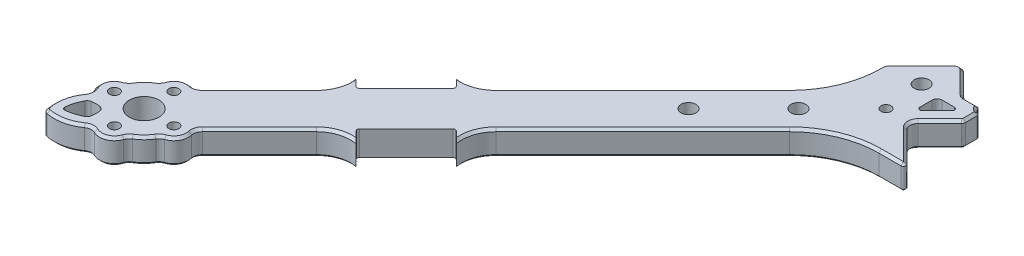
from build123d import *

# Parameters (mm, degrees)
SKETCH_1_R          = 1
SKETCH_1_R_2        = 3
SKETCH_1_R_3        = 1.5
EXTRUDE_1_DEPTH     = 5
SKETCH_3_R          = 1.2
CUT_EXTRUDE_1_DEPTH = 135.696498343
FILLET_1_R          = 0.5
EXTRUDE_2_DEPTH     = 5
CHAMFER_1_SIZE      = 0.5
FILLET_2_R          = 0.5


with BuildPart() as part:
    # 草图1 → 凸台-拉伸1 (new body)
    with BuildSketch(Plane(origin=(0, 0, 0), x_dir=(1, 0, 0), z_dir=(0, 1, 0))):
        with BuildLine():
            Line((-1.05, -0.05), (-3.878932188, -0.05))
            ThreePointArc((-3.878932188, -0.05), (-4.26161562, 0.026120467), (-4.586038969, 0.242893219))
            Line((-4.586038969, 0.242893219), (-8.939339828, 4.596194078))
            ThreePointArc((-8.939339828, 4.596194078), (-10, 5.035533906), (-11.060660172, 4.596194078))
            Line((-11.060660172, 4.596194078), (-17.414213562, -1.757359313))
            ThreePointArc((-17.414213562, -1.757359313), (-17.847759065, -2.406206011), (-18, -3.171572875))
            Line((-18, -3.171572875), (-18, -3.473088065))
            ThreePointArc((-18, -3.473088065), (-19.370168415, -10.361389848), (-23.272077939, -16.201010127))
            Line((-23.272077939, -16.201010127), (-82.516073867, -75.445006056))
            ThreePointArc((-82.516073867, -75.445006056), (-83.289794817, -75.901643779), (-84.187846449, -75.927438809))
            ThreePointArc((-84.187846449, -75.927438809), (-86.320147495, -76.236149519), (-87.69562876, -77.894480409))
            ThreePointArc((-87.69562876, -77.894480409), (-87.997588969, -78.446221486), (-88.470941946, -78.8603895))
            ThreePointArc((-88.470941946, -78.8603895), (-89.802561211, -79.903066274), (-90.845237985, -81.234685539))
            ThreePointArc((-90.845237985, -81.234685539), (-91.259405999, -81.708038515), (-91.811147076, -82.009998725))
            ThreePointArc((-91.811147076, -82.009998725), (-93.624506867, -83.704895094), (-93.54050492, -86.185598847))
            ThreePointArc((-93.54050492, -86.185598847), (-93.358877315, -87.129125834), (-93.688515602, -88.031661353))
            ThreePointArc((-93.688515602, -88.031661353), (-94.999717774, -90.997373171), (-95.0260644, -94.239903599))
            ThreePointArc((-95.0260644, -94.239903599), (-94.752308679, -94.752308679), (-94.239903599, -95.0260644))
            ThreePointArc((-94.239903599, -95.0260644), (-90.997373171, -94.999717774), (-88.031661353, -93.688515602))
            ThreePointArc((-88.031661353, -93.688515602), (-87.129125834, -93.358877315), (-86.185598847, -93.54050492))
            ThreePointArc((-86.185598847, -93.54050492), (-83.704895094, -93.624506867), (-82.009998725, -91.811147076))
            ThreePointArc((-82.009998725, -91.811147076), (-81.708038515, -91.259405999), (-81.234685539, -90.845237985))
            ThreePointArc((-81.234685539, -90.845237985), (-79.903066274, -89.802561211), (-78.8603895, -88.470941946))
            ThreePointArc((-78.8603895, -88.470941946), (-78.446221486, -87.997588969), (-77.894480409, -87.69562876))
            ThreePointArc((-77.894480409, -87.69562876), (-76.236149519, -86.320147495), (-75.927438809, -84.187846449))
            ThreePointArc((-75.927438809, -84.187846449), (-75.901643779, -83.289794817), (-75.445006056, -82.516073867))
            Line((-75.445006056, -82.516073867), (-16.201010127, -23.272077939))
            ThreePointArc((-16.201010127, -23.272077939), (-10.361389848, -19.370168415), (-3.473088065, -18))
            Line((-3.473088065, -18), (0.994617613, -18))
            ThreePointArc((0.994617613, -18), (1.456557379, -17.691341716), (1.348171004, -17.146446609))
            Line((1.348171004, -17.146446609), (-4.666904756, -11.13137085))
            ThreePointArc((-4.666904756, -11.13137085), (-5.135533906, -10), (-4.666904756, -8.86862915))
            Line((-4.666904756, -8.86862915), (-0.313603897, -4.515328291))
            ThreePointArc((-0.313603897, -4.515328291), (-0.118508421, -4.223347277), (-0.05, -3.878932188))
            Line((-0.05, -3.878932188), (-0.05, -1.05))
            ThreePointArc((-0.05, -1.05), (-0.342893219, -0.342893219), (-1.05, -0.05))
        make_face()
        with Locations(Location((-10, -10, 0), (0, 0, 270))):
            Circle(SKETCH_1_R, mode=Mode.SUBTRACT)
        with Locations(Location((-84.852813742, -78.852813742, 0), (0, 0, 270))):
            Circle(SKETCH_1_R, mode=Mode.SUBTRACT)
        with Locations(Location((-90.852813742, -84.852813742, 0), (0, 0, 270))):
            Circle(SKETCH_1_R, mode=Mode.SUBTRACT)
        with Locations(Location((-84.852813742, -90.852813742, 0), (0, 0, 270))):
            Circle(SKETCH_1_R, mode=Mode.SUBTRACT)
        with Locations(Location((-78.852813742, -84.852813742, 0), (0, 0, 270))):
            Circle(SKETCH_1_R, mode=Mode.SUBTRACT)
        with Locations(Location((-84.852813742, -84.852813742, 0), (0, 0, 270))):
            Circle(SKETCH_1_R_2, mode=Mode.SUBTRACT)
        with Locations(Location((-29.933672392, -29.933672392, 0), (0, 0, 270))):
            Circle(SKETCH_1_R_3, mode=Mode.SUBTRACT)
        with Locations(Location((-18.838834765, -18.838834765, 0), (0, 0, 270))):
            Circle(SKETCH_1_R_3, mode=Mode.SUBTRACT)
        with Locations(Location((-10.707106781, -2.121320344, 0), (0, 0, 270))):
            Circle(SKETCH_1_R_3, mode=Mode.SUBTRACT)
        with BuildLine():
            Line((-3.35, -2.85), (-5.85, -2.85))
            ThreePointArc((-5.85, -2.85), (-6.557106781, -3.142893219), (-6.85, -3.85))
            Line((-6.85, -3.85), (-6.85, -6.35))
            ThreePointArc((-6.85, -6.35), (-6.541341716, -6.811939766), (-5.996446609, -6.703553391))
            Line((-5.996446609, -6.703553391), (-2.996446609, -3.703553391))
            ThreePointArc((-2.996446609, -3.703553391), (-2.888060234, -3.158658284), (-3.35, -2.85))
        make_face(mode=Mode.SUBTRACT)
        with BuildLine():
            ThreePointArc((-89.737673169, -88.905924048), (-90.608551839, -88.844523313), (-91.47704317, -88.933531827))
            ThreePointArc((-91.47704317, -88.933531827), (-91.873077603, -89.10358999), (-92.160754462, -89.424534028))
            ThreePointArc((-92.160754462, -89.424534028), (-92.817301251, -90.955059318), (-93.129383371, -92.590958489))
            ThreePointArc((-93.129383371, -92.590958489), (-92.984541726, -92.984541726), (-92.590958489, -93.129383371))
            ThreePointArc((-92.590958489, -93.129383371), (-90.955059318, -92.817301251), (-89.424534028, -92.160754462))
            ThreePointArc((-89.424534028, -92.160754462), (-89.10358999, -91.873077603), (-88.933531827, -91.47704317))
            ThreePointArc((-88.933531827, -91.47704317), (-88.844523313, -90.608551839), (-88.905924048, -89.737673169))
            ThreePointArc((-88.905924048, -89.737673169), (-89.18657324, -89.18657324), (-89.737673169, -88.905924048))
        make_face(mode=Mode.SUBTRACT)
    extrude(amount=EXTRUDE_1_DEPTH)

    # 草图3 → 切除-拉伸1 (cut, through all)
    with BuildSketch(Plane.XZ):
        Circle(SKETCH_3_R)
    extrude(amount=-CUT_EXTRUDE_1_DEPTH, mode=Mode.SUBTRACT)

    # 圆角1
    fillet_1_edges = [part.edges().sort_by_distance(p)[0] for p in [
        (-0.05, 2.5, 1.198957881),
        (-1.198957881, 2.5, 0.05),
    ]]
    fillet(fillet_1_edges, radius=FILLET_1_R)

    # 草图4 → 凸台-拉伸2 (add)
    with BuildSketch(Plane(origin=(0, 5, 0), x_dir=(1, 0, 0), z_dir=(0, 1, 0))):
        with BuildLine():
            Line((-59.019055474, -47.705346975), (-56.89773513, -49.826667319))
            Line((-56.89773513, -49.826667319), (-52.894075903, -45.823008091))
            ThreePointArc((-52.894075903, -45.823008091), (-55.72263259, -47.52537705), (-59.019055474, -47.705346975))
        make_face()
        with BuildLine():
            Line((-67.003521209, -59.932453397), (-71.007180437, -63.936112625))
            ThreePointArc((-71.007180437, -63.936112625), (-69.304811478, -61.107555938), (-69.124841553, -57.811133054))
            Line((-69.124841553, -57.811133054), (-67.003521209, -59.932453397))
        make_face()
        with BuildLine():
            Line((-57.811133054, -69.124841553), (-59.932453397, -67.003521209))
            Line((-59.932453397, -67.003521209), (-63.936112625, -71.007180437))
            ThreePointArc((-63.936112625, -71.007180437), (-61.107555938, -69.304811478), (-57.811133054, -69.124841553))
        make_face()
        with BuildLine():
            Line((-49.826667319, -56.89773513), (-45.823008091, -52.894075903))
            ThreePointArc((-45.823008091, -52.894075903), (-47.52537705, -55.72263259), (-47.705346975, -59.019055474))
            Line((-47.705346975, -59.019055474), (-49.826667319, -56.89773513))
        make_face()
    extrude(amount=-EXTRUDE_2_DEPTH)

    # 倒角1
    chamfer_1_edges = [part.edges().sort_by_distance(p)[0] for p in [
        (-1.239235226, 5, 18),
        (1.456557379, 5, 17.691341716),
        (-1.659366876, 5, 14.13890873),
        (-5.135533906, 5, 10),
        (-2.490254326, 5, 6.691978721),
        (-0.118508421, 5, 4.223347277),
        (-4.26161562, 5, -0.026120467),
        (-6.762689399, 5, -2.419543648),
        (-2.743751491, 5, 0.05),
        (-2.743751491, 0, 0.05),
        (-10, 5, -5.035533906),
        (-0.848528137, 0, 0.848528137),
        (-0.05, 0, 2.743751491),
        (-0.143255392, 0, 1.317780795),
        (-1.317780795, 0, 0.143255392),
        (-0.848528137, 5, 0.848528137),
        (-0.05, 5, 2.743751491),
        (-0.143255392, 5, 1.317780795),
        (-1.317780795, 5, 0.143255392),
        (-14.237436867, 5, -1.419417382),
        (-17.847759065, 5, 2.406206011),
        (-55.72263259, 5, 47.52537705),
        (-18, 5, 3.32233047),
        (-55.72263259, 0, 47.52537705),
        (-19.370168415, 5, 10.361389848),
        (-76.761627152, 0, 69.69055934),
        (-76.761627152, 5, 69.69055934),
        (-69.304811478, 5, 61.107555938),
        (-69.304811478, 0, 61.107555938),
        (-38.083076921, 5, 31.012009109),
        (-83.289794817, 5, 75.901643779),
        (-61.107555938, 5, 69.304811478),
        (-61.107555938, 0, 69.304811478),
        (-86.320147495, 5, 76.236149519),
        (-31.012009109, 0, 38.083076921),
        (-31.012009109, 5, 38.083076921),
        (-87.997588969, 5, 78.446221486),
        (-47.52537705, 5, 55.72263259),
        (-47.52537705, 0, 55.72263259),
        (-89.802561211, 5, 79.903066274),
        (-91.259405999, 5, 81.708038515),
        (-93.624506867, 5, 83.704895094),
        (-93.358877315, 5, 87.129125834),
        (-94.999717774, 5, 90.997373171),
        (-94.752308679, 5, 94.752308679),
        (-90.997373171, 5, 94.999717774),
        (-87.129125834, 5, 93.358877315),
        (-83.704895094, 5, 93.624506867),
        (-81.708038515, 5, 91.259405999),
        (-79.903066274, 5, 89.802561211),
        (-78.446221486, 5, 87.997588969),
        (-76.236149519, 5, 86.320147495),
        (-75.901643779, 5, 83.289794817),
        (-69.69055934, 5, 76.761627152),
        (-10.361389848, 5, 19.370168415),
        (-10.361389848, 0, 19.370168415),
        (-69.69055934, 0, 76.761627152),
        (-75.901643779, 0, 83.289794817),
        (-76.236149519, 0, 86.320147495),
        (-78.446221486, 0, 87.997588969),
        (-79.903066274, 0, 89.802561211),
        (-81.708038515, 0, 91.259405999),
        (-83.704895094, 0, 93.624506867),
        (-87.129125834, 0, 93.358877315),
        (-90.997373171, 0, 94.999717774),
        (-94.752308679, 0, 94.752308679),
        (-94.999717774, 0, 90.997373171),
        (-93.358877315, 0, 87.129125834),
        (-93.624506867, 0, 83.704895094),
        (-91.259405999, 0, 81.708038515),
        (-89.802561211, 0, 79.903066274),
        (-87.997588969, 0, 78.446221486),
        (-86.320147495, 0, 76.236149519),
        (-83.289794817, 0, 75.901643779),
        (-38.083076921, 0, 31.012009109),
        (-19.370168415, 0, 10.361389848),
        (-18, 0, 3.32233047),
        (-17.847759065, 0, 2.406206011),
        (-14.237436867, 0, -1.419417382),
        (-10, 0, -5.035533906),
        (-6.762689399, 0, -2.419543648),
        (-4.26161562, 0, -0.026120467),
        (-0.118508421, 0, 4.223347277),
        (-2.490254326, 0, 6.691978721),
        (-5.135533906, 0, 10),
        (-1.659366876, 0, 14.13890873),
        (1.456557379, 0, 17.691341716),
        (-1.239235226, 0, 18),
    ]]
    chamfer(chamfer_1_edges, length=CHAMFER_1_SIZE - 0.0001)  # a hair under: the kernel refuses the full size

    # 圆角2
    fillet_2_edges = [part.edges().sort_by_distance(p)[0] for p in [
        (-56.89773513, 2.5, 49.826667319),
        (-67.003521209, 2.5, 59.932453397),
        (-59.932453397, 2.5, 67.003521209),
        (-49.826667319, 2.5, 56.89773513),
    ]]
    fillet(fillet_2_edges, radius=FILLET_2_R)


solid = part.part
